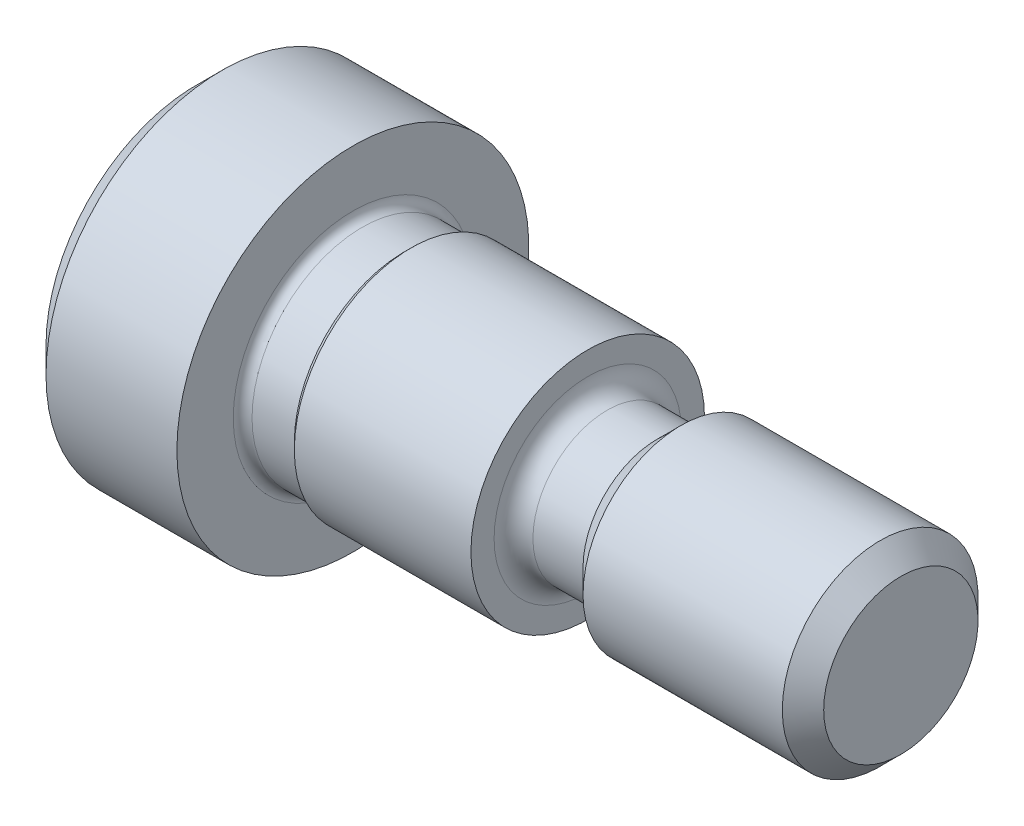
from build123d import *

# Parameters (mm, degrees)
HEX_2_DEPTH = 3.5814


# Read off the part's stored shape, not the designer's step: ThreadSchematic
with BuildPart() as part:
    # ThreadSchematic outline → ThreadSchematic (revolve)
    with BuildSketch(Plane.YX):
        with BuildLine():
            Line((0, 28.575), (0, 0))
            Line((0, 0), (6.096, 0))
            Line((6.096, 0), (7.1374, 1.0414))
            Line((7.1374, 1.0414), (7.1374, 6.35))
            Line((7.1374, 6.35), (4.8514, 6.35))
            ThreePointArc((4.8514, 6.35), (4.581992316, 6.461592316), (4.4704, 6.731))
            Line((4.4704, 6.731), (4.4704, 8.4455))
            Line((4.4704, 8.4455), (4.7371, 8.7122))
            Line((4.7371, 8.7122), (4.7371, 15.875))
            Line((4.7371, 15.875), (3.7973, 15.875))
            ThreePointArc((3.7973, 15.875), (3.24052412, 16.10562412), (3.0099, 16.6624))
            Line((3.0099, 16.6624), (3.0099, 18.6944))
            Line((3.0099, 18.6944), (3.96875, 19.65325))
            Line((3.96875, 19.65325), (3.96875, 27.73553))
            Line((3.96875, 27.73553), (3.12928, 28.575))
            Line((3.12928, 28.575), (0, 28.575))
        make_face()
    revolve(axis=Axis((0, 0, 0), (1, 0, 0)))

    # Sketch2 → PreBroach (revolve, cut)
    with BuildSketch(Plane.XY, mode=Mode.PRIVATE) as prebroach_sk:
        Polygon((0, 2.3876), (3.5814, 2.3876), (4.959881503, 0), (0, 0), align=None)
    revolve(prebroach_sk.sketch.rotate(Axis((0, 0, 0), (1, 0, 0)), 90), axis=Axis((0, 0, 0), (1, 0, 0)), mode=Mode.SUBTRACT)

    # Sketch3 → Hex 2 (cut)
    with BuildSketch(Plane.ZY):
        Polygon((-2.3876, -1.378481503), (-2.3876, 1.378481503), (0, 2.756963005), (2.3876, 1.378481503), (2.3876, -1.378481503), (0, -2.756963005), align=None)
    extrude(amount=-HEX_2_DEPTH, mode=Mode.SUBTRACT)


solid = part.part
